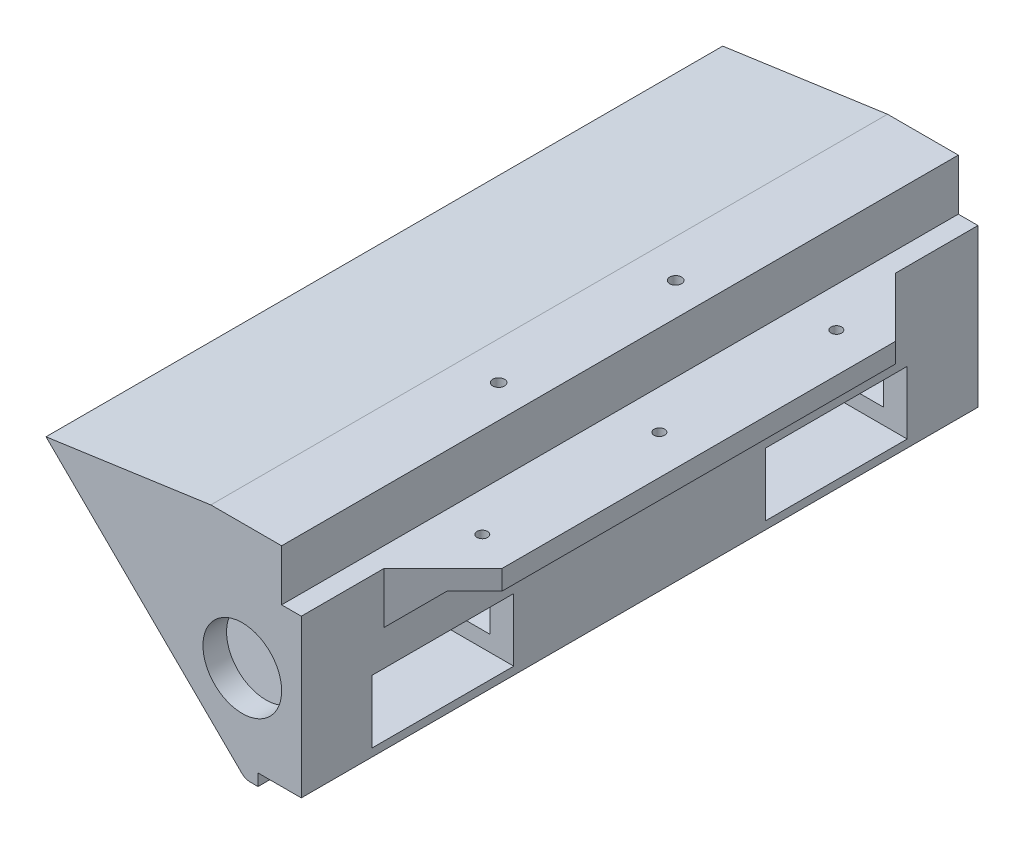
from build123d import *

# Parameters (mm, degrees)
EXTRUDE_1_DEPTH     = 172
SHELL_START         = 6
SHELL_1_DEPTH       = 160
SKETCH_2_W          = 36
SKETCH_2_H          = 16
CUT_EXTRUDE_1_DEPTH = 74
EXTRUDE_2_DEPTH     = 2
SKETCH_4_R          = 10
CUT_EXTRUDE_2_DEPTH = 186
SKETCH_5_R          = 1.5
CUT_EXTRUDE_3_DEPTH = 10
EXTRUDE_3_DEPTH     = 172
SKETCH_7_W          = 36
SKETCH_7_H          = 16
CUT_EXTRUDE_4_DEPTH = 172
SKETCH_8_W          = 6
SKETCH_8_H          = 172
CUT_EXTRUDE_5_DEPTH = 3
EXTRUDE_4_DEPTH     = 15
CHAMFER_1_SIZE      = 15
CHAMFER_2_SIZE      = 15
CHAMFER_3_SIZE      = 8
SKETCH_10_R         = 1.35
CUT_EXTRUDE_6_DEPTH = 15
SKETCH_12_R         = 1.35
CUT_EXTRUDE_7_DEPTH = 15
CUT_EXTRUDE_8_DEPTH = 78
CUT_EXTRUDE_9_DEPTH = 78


# Read off the part's stored shape, not the designer's step: 抽壳1
with BuildPart() as part:
    # 草图1 → 凸台-拉伸1 (new body)
    with BuildSketch(Plane.XY):
        with BuildLine():
            Line((0, 0), (0, 40))
            Line((0, 40), (-5, 40))
            Line((-5, 40), (-5, 53))
            Line((-5, 53), (-23, 53))
            Line((-23, 53), (-64.888578151, 47.050698608))
            Line((-64.888578151, 47.050698608), (-15.121320344, -2.121320344))
            ThreePointArc((-15.121320344, -2.121320344), (-14.148050297, -2.771638598), (-13, -3))
            Line((-13, -3), (-5, -3))
            Line((-5, -3), (-5, 0))
            Line((-5, 0), (0, 0))
        make_face()
    extrude(amount=EXTRUDE_1_DEPTH)

    # 抽壳1 outline → 抽壳1 (cut)
    with BuildSketch(Plane.XY.offset(SHELL_START)):
        Polygon((-11, 6), (-6, 6), (-6, 34), (-11, 34), (-11, 47), (-22.576046832, 47), (-52.061983815, 42.812206246), (-11.767841448, 3), (-11, 3), align=None)
    extrude(amount=SHELL_1_DEPTH, mode=Mode.SUBTRACT)

    # 草图2 → 切除-拉伸1 (cut)
    with BuildSketch(Plane(origin=(0, 0, 0), x_dir=(0, 0, -1), z_dir=(1, 0, 0))):
        with Locations((-136, 10)):
            Rectangle(SKETCH_2_W, SKETCH_2_H)
        with Locations((-36, 10)):
            Rectangle(SKETCH_2_W, SKETCH_2_H)
    extrude(amount=-CUT_EXTRUDE_1_DEPTH, mode=Mode.SUBTRACT)

    # 草图3 → 凸台-拉伸2 (add, symmetric)
    with BuildSketch(Plane(origin=(0, 0, 86), x_dir=(-1, 0, 0), z_dir=(0, 0, -1))):
        Polygon((5, 53), (5, 40), (0, 40), (0, 0), (5, 0), (5, -3), (13, -3), (16.579355858, -0.680723591), (64.888578151, 47.050698608), (23, 53), align=None)
    extrude(amount=EXTRUDE_2_DEPTH, both=True)

    # 草图4 → 切除-拉伸2 (cut)
    with BuildSketch(Plane.XY.offset(172)):
        with Locations((-15, 21.071297481)):
            Circle(SKETCH_4_R)
    extrude(amount=-CUT_EXTRUDE_2_DEPTH, mode=Mode.SUBTRACT)

    # 草图5 → 切除-拉伸3 (cut)
    with BuildSketch(Plane(origin=(0, 53, 0), x_dir=(1, 0, 0), z_dir=(0, 1, 0))):
        with Locations(Location((-13.338195438, -63.5, 0), (0, 0, 270))):
            Circle(SKETCH_5_R)
        with Locations(Location((-13.338195438, -108.5, 0), (0, 0, 270))):
            Circle(SKETCH_5_R)
    extrude(amount=-CUT_EXTRUDE_3_DEPTH, mode=Mode.SUBTRACT)

    # 草图6 → 凸台-拉伸3 (add)
    with BuildSketch(Plane.XY.offset(172)):
        Polygon((-11, 6), (-14.804157153, 6), (-11.767841448, 3), (-11, 3), align=None)
    extrude(amount=-EXTRUDE_3_DEPTH)

    # 草图7 → 切除-拉伸4 (cut)
    with BuildSketch(Plane(origin=(0, 0, 0), x_dir=(0, 0, -1), z_dir=(1, 0, 0))):
        with Locations((-136, 10)):
            Rectangle(SKETCH_7_W, SKETCH_7_H)
        with Locations((-36, 10)):
            Rectangle(SKETCH_7_W, SKETCH_7_H)
    extrude(amount=-CUT_EXTRUDE_4_DEPTH, mode=Mode.SUBTRACT)

    # 草图8 → 切除-拉伸5 (cut)
    with BuildSketch(Plane.XZ.offset(3)):
        with Locations((-8, 86)):
            Rectangle(SKETCH_8_W, SKETCH_8_H)
    extrude(amount=-CUT_EXTRUDE_5_DEPTH, mode=Mode.SUBTRACT)

    # 草图9 → 凸台-拉伸4 (add)
    with BuildSketch(Plane(origin=(0, 0, 0), x_dir=(0, 0, -1), z_dir=(1, 0, 0))):
        Polygon((-86, 40), (-151, 40), (-151, 35), (-86, 35), (-21, 35), (-21, 40), align=None)
    extrude(amount=EXTRUDE_4_DEPTH)

    # 倒角1
    chamfer_1_edges = [part.edges().sort_by_distance(p)[0] for p in [
        (15, 37.5, 151),
    ]]
    chamfer(chamfer_1_edges, length=CHAMFER_1_SIZE - 0.0001)  # a hair under: the kernel refuses the full size

    # 倒角2
    chamfer_2_edges = [part.edges().sort_by_distance(p)[0] for p in [
        (15, 37.5, 21),
    ]]
    chamfer(chamfer_2_edges, length=CHAMFER_2_SIZE - 0.0001)  # a hair under: the kernel refuses the full size

    # 倒角3
    chamfer_3_edges = [part.edges().sort_by_distance(p)[0] for p in [
        (0, 35, 86),
    ]]
    chamfer(chamfer_3_edges, length=CHAMFER_3_SIZE)

    # 草图10 → 切除-拉伸6 (cut)
    with BuildSketch(Plane.XZ):
        with Locations((-5, 158)):
            Circle(SKETCH_10_R)
        with Locations((-5, 111)):
            Circle(SKETCH_10_R)
        with Locations((-5, 61)):
            Circle(SKETCH_10_R)
        with Locations((-5, 14.01360213)):
            Circle(SKETCH_10_R)
    extrude(amount=-CUT_EXTRUDE_6_DEPTH, mode=Mode.SUBTRACT)

    # 草图12 → 切除-拉伸7 (cut)
    with BuildSketch(Plane(origin=(0, 40, 0), x_dir=(1, 0, 0), z_dir=(0, 1, 0))):
        with Locations(Location((5, -41, 0), (0, 0, 270))):
            Circle(SKETCH_12_R)
        with Locations(Location((5, -86, 0), (0, 0, 270))):
            Circle(SKETCH_12_R)
        with Locations(Location((5, -131, 0), (0, 0, 270))):
            Circle(SKETCH_12_R)
    extrude(amount=-CUT_EXTRUDE_7_DEPTH, mode=Mode.SUBTRACT)

    # 草图14 → 切除-拉伸8 (cut)
    with BuildSketch(Plane(origin=(0, 0, 84), x_dir=(-1, 0, 0), z_dir=(0, 0, -1))):
        Polygon((11, 47), (6, 34), (11, 34), align=None)
    extrude(amount=CUT_EXTRUDE_8_DEPTH, mode=Mode.SUBTRACT)

    # 草图16 → 切除-拉伸9 (cut)
    with BuildSketch(Plane.XY.offset(88)):
        Polygon((-11, 47), (-11, 34), (-6, 34), align=None)
    extrude(amount=CUT_EXTRUDE_9_DEPTH, mode=Mode.SUBTRACT)


solid = part.part
